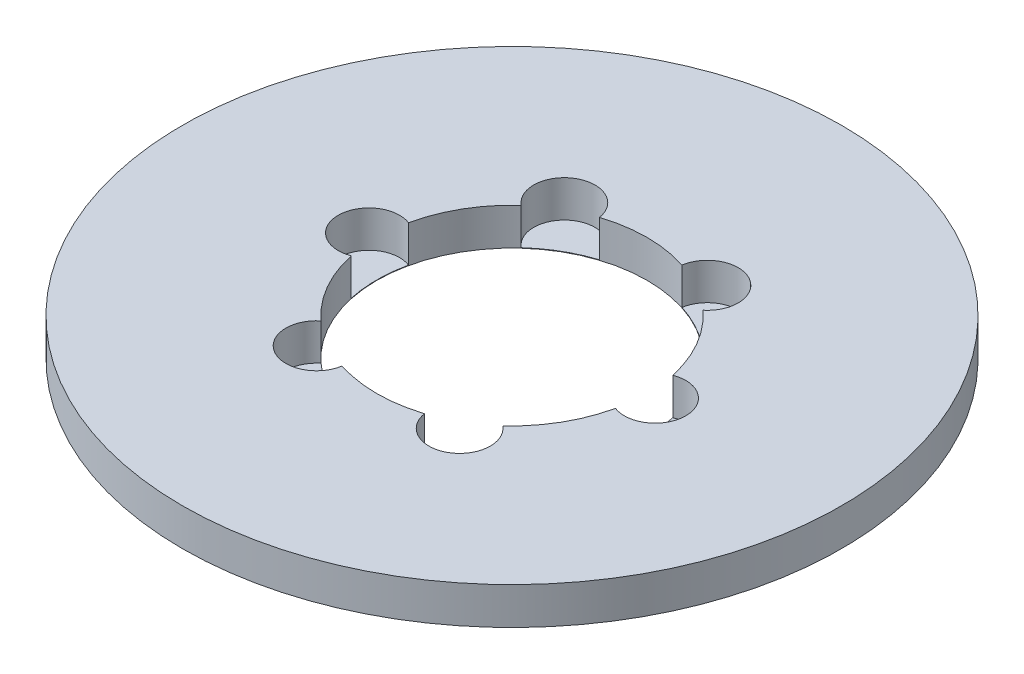
from build123d import *

# Parameters (mm, degrees)
SKETCH1_R           = 97.5
BOSS_EXTRUDE1_DEPTH = 11
SKETCH2_R           = 40
CUT_EXTRUDE1_DEPTH  = 139.32389526
SKETCH3_R           = 9.076292855
CUT_EXTRUDE2_DEPTH  = 10.865479256
CIRPATTERN1_COUNT   = 6


with BuildPart() as part:
    # Sketch1 → Boss-Extrude1 (new body)
    with BuildSketch(Plane(origin=(0, 0, 0), x_dir=(1, 0, 0), z_dir=(0, 1, 0))):
        Circle(SKETCH1_R)
    extrude(amount=BOSS_EXTRUDE1_DEPTH)

    # Sketch2 → Cut-Extrude1 (cut, through all)
    with BuildSketch(Plane(origin=(0, 0, 0), x_dir=(1, 0, 0), z_dir=(0, 1, 0))):
        Circle(SKETCH2_R)
    extrude(amount=CUT_EXTRUDE1_DEPTH, mode=Mode.SUBTRACT)

    # Sketch3 → Cut-Extrude2 (cut)
    with BuildSketch(Plane(origin=(0, 11, 0), x_dir=(1, 0, 0), z_dir=(0, 1, 0))):
        with Locations((-42.332277867, 0)):
            Circle(SKETCH3_R)
    cut_extrude2 = extrude(amount=-CUT_EXTRUDE2_DEPTH, mode=Mode.SUBTRACT)

    # CirPattern1: Cut-Extrude2 ×6 about axis
    cirpattern1_axis = Axis((0, 0, 0), (0, 1, 0))
    for i in range(1, CIRPATTERN1_COUNT):
        add(cut_extrude2.rotate(cirpattern1_axis, i * 360 / CIRPATTERN1_COUNT), mode=Mode.SUBTRACT)


solid = part.part
